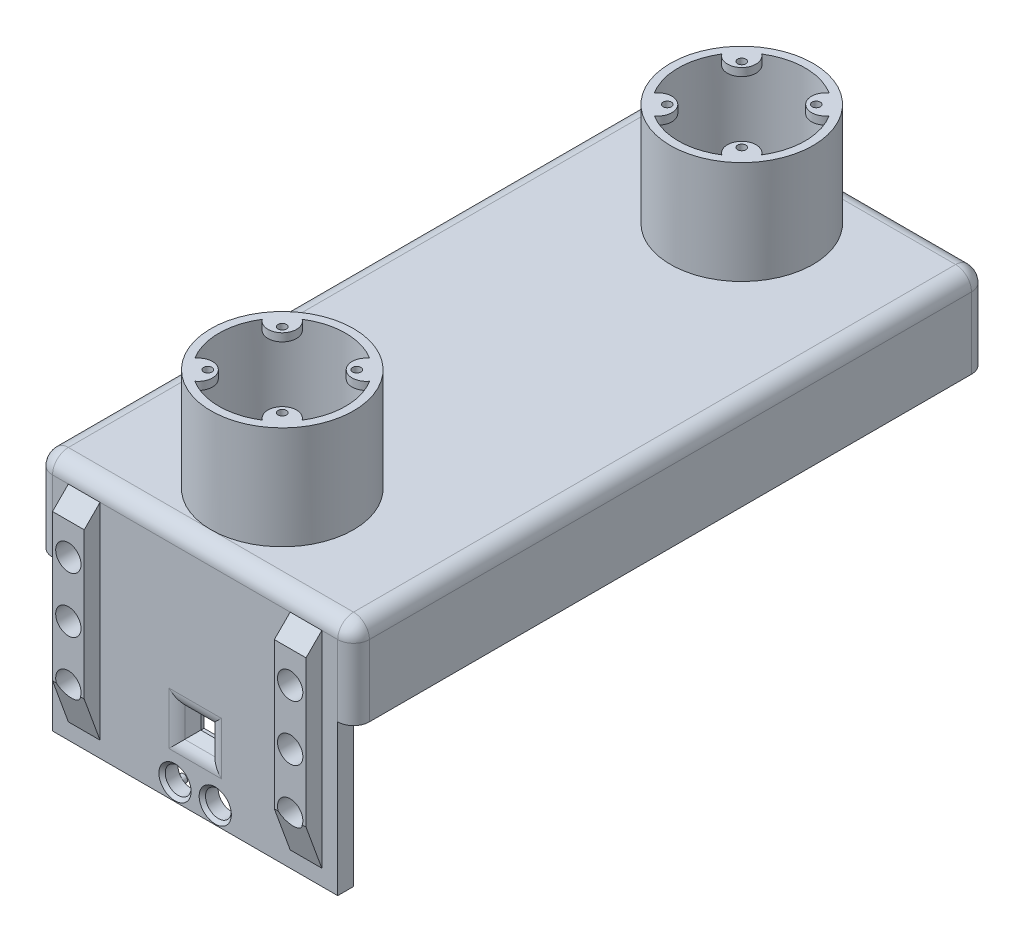
from build123d import *
from build123d.topology import SkipClean

# Parameters (mm, degrees)
SKETCH1_W            = 180
SKETCH1_H            = 150
BOSS_EXTRUDE1_DEPTH  = 10
SKETCH2_W            = 20
SKETCH2_H            = 130
BOSS_EXTRUDE2_DEPTH  = 10
CUT_EXTRUDE1_REACH   = 120.849
SKETCH3_R            = 8
CHAMFER1_SIZE        = 10
CHAMFER2_SIZE        = 27.474774195
CHAMFER2_SIZE_2      = 10
SKETCH5_W            = 200
SKETCH5_H            = 400
BOSS_EXTRUDE4_DEPTH  = 10
SKETCH6_W            = 200
SKETCH6_H            = 55
BOSS_EXTRUDE5_DEPTH  = 10
SKETCH7_W            = 10
SKETCH7_H            = 400
BOSS_EXTRUDE6_DEPTH  = 45
FILLET1_R            = 10
SKETCH9_R            = 40
CUT_EXTRUDE2_DEPTH   = 10
SKETCH10_W           = 380
SKETCH10_H           = 10
BOSS_EXTRUDE7_DEPTH  = 180
SKETCH11_W           = 180
SKETCH11_H           = 200
SKETCH11_W_2         = 30
SKETCH11_H_2         = 20
CUT_EXTRUDE5_DEPTH   = 10
BOSS_EXTRUDE8_START  = 60
SKETCH13_R           = 45
SKETCH13_R_2         = 40
BOSS_EXTRUDE8_DEPTH  = 60
BOSS_EXTRUDE9_START  = 5
SKETCH14_R           = 45
SKETCH14_R_2         = 2.6
BOSS_EXTRUDE9_DEPTH  = 5
SKETCH17_R           = 2.5
SKETCH17_R_2         = 1.5
BOSS_EXTRUDE10_DEPTH = 3
SKETCH18_R           = 8.15
CUT_EXTRUDE6_DEPTH   = 427.262829719
CHAMFER3_SIZE        = 2
SKETCH20_R           = 1.8
SKETCH20_R_2         = 1.05
BOSS_EXTRUDE11_DEPTH = 2
SKETCH21_W           = 8.8
SKETCH21_H           = 8.8
CUT_EXTRUDE7_DEPTH   = 427.262829719
CHAMFER4_SIZE        = 8
FILLET2_R            = 10
SKETCH22_W           = 180
SKETCH22_H           = 380
CUT_EXTRUDE8_DEPTH   = 10


# Some blends are built 0.0001 mm under size
with BuildPart() as part:
    # Sketch1 → Boss-Extrude1 (new body)
    with BuildSketch(Plane.XY):
        Rectangle(SKETCH1_W, SKETCH1_H)
    extrude(amount=BOSS_EXTRUDE1_DEPTH)

    # Sketch2 → Boss-Extrude2 (add)
    with BuildSketch(Plane.XY.offset(10)):
        with Locations((70, 0)):
            Rectangle(SKETCH2_W, SKETCH2_H)
        with Locations((-70, 0)):
            Rectangle(SKETCH2_W, SKETCH2_H)
    extrude(amount=BOSS_EXTRUDE2_DEPTH)

    # Sketch3 → Cut-Extrude1 (cut, up to next)
    with BuildSketch(Plane.XY.offset(20), mode=Mode.PRIVATE) as cut_extrude1_sk1:
        with Locations((-70, 0)):
            Circle(SKETCH3_R)
    cut_extrude1_tool1 = extrude(cut_extrude1_sk1.sketch, amount=-CUT_EXTRUDE1_REACH, mode=Mode.PRIVATE) & part.part
    # Sketch3 → Cut-Extrude1 (cut, up to next)
    with BuildSketch(Plane.XY.offset(20), mode=Mode.PRIVATE) as cut_extrude1_sk2:
        with Locations((-70, -35)):
            Circle(SKETCH3_R)
    cut_extrude1_tool2 = extrude(cut_extrude1_sk2.sketch, amount=-CUT_EXTRUDE1_REACH, mode=Mode.PRIVATE) & part.part
    # Sketch3 → Cut-Extrude1 (cut, up to next)
    with BuildSketch(Plane.XY.offset(20), mode=Mode.PRIVATE) as cut_extrude1_sk3:
        with Locations((-70, 35)):
            Circle(SKETCH3_R)
    cut_extrude1_tool3 = extrude(cut_extrude1_sk3.sketch, amount=-CUT_EXTRUDE1_REACH, mode=Mode.PRIVATE) & part.part
    # Sketch3 → Cut-Extrude1 (cut, up to next)
    with BuildSketch(Plane.XY.offset(20), mode=Mode.PRIVATE) as cut_extrude1_sk4:
        with Locations(Location((70, -35, 0), (0, 0, 180))):
            Circle(SKETCH3_R)
    cut_extrude1_tool4 = extrude(cut_extrude1_sk4.sketch, amount=-CUT_EXTRUDE1_REACH, mode=Mode.PRIVATE) & part.part
    # Sketch3 → Cut-Extrude1 (cut, up to next)
    with BuildSketch(Plane.XY.offset(20), mode=Mode.PRIVATE) as cut_extrude1_sk5:
        with Locations(Location((70, 0, 0), (0, 0, 180))):
            Circle(SKETCH3_R)
    cut_extrude1_tool5 = extrude(cut_extrude1_sk5.sketch, amount=-CUT_EXTRUDE1_REACH, mode=Mode.PRIVATE) & part.part
    # Sketch3 → Cut-Extrude1 (cut, up to next)
    with BuildSketch(Plane.XY.offset(20), mode=Mode.PRIVATE) as cut_extrude1_sk6:
        with Locations(Location((70, 35, 0), (0, 0, 180))):
            Circle(SKETCH3_R)
    cut_extrude1_tool6 = extrude(cut_extrude1_sk6.sketch, amount=-CUT_EXTRUDE1_REACH, mode=Mode.PRIVATE) & part.part
    add(cut_extrude1_tool1.solids().sort_by_distance((-70, 0, 20))[0], mode=Mode.SUBTRACT)
    add(cut_extrude1_tool2.solids().sort_by_distance((-70, -35, 20))[0], mode=Mode.SUBTRACT)
    add(cut_extrude1_tool3.solids().sort_by_distance((-70, 35, 20))[0], mode=Mode.SUBTRACT)
    add(cut_extrude1_tool4.solids().sort_by_distance((70, -35, 20))[0], mode=Mode.SUBTRACT)
    add(cut_extrude1_tool5.solids().sort_by_distance((70, 0, 20))[0], mode=Mode.SUBTRACT)
    add(cut_extrude1_tool6.solids().sort_by_distance((70, 35, 20))[0], mode=Mode.SUBTRACT)

    # Chamfer1
    chamfer1_edges = [part.edges().sort_by_distance(p)[0] for p in [
        (70, 65, 20),
        (-70, 65, 20),
    ]]
    chamfer(chamfer1_edges, length=CHAMFER1_SIZE - 0.0001)  # a hair under: the kernel refuses the full size

    # Chamfer2
    # the kernel refuses this chamfer: 27.474774195, 10 mm, written as the material it takes off along each edge
    with BuildSketch(Plane(origin=(-11.274914494, -65, 20), x_dir=(0, 0.9999130865277315, 0.013184058198645822), z_dir=(1, 0, 0))) as chamfer2_piece_1_section:
        Polygon((CHAMFER2_SIZE * 0.999913086511, -CHAMFER2_SIZE * 0.0131840581984), (-CHAMFER2_SIZE_2 * 0.0131840581986, -CHAMFER2_SIZE_2 * 0.999913086528), (0, 0), align=None)
    chamfer2_piece_1 = extrude(amount=162.549828987, mode=Mode.PRIVATE)
    chamfer2_piece_1 = split(chamfer2_piece_1, bisect_by=Plane(origin=(70, -55.574652425, 10), z_dir=(0, 0, 1)), keep=Keep.TOP, mode=Mode.PRIVATE)
    add(chamfer2_piece_1, mode=Mode.SUBTRACT)
    with BuildSketch(Plane(origin=(-151.274914494, -65, 20), x_dir=(0, -0.09904090225205088, -0.9950833631817486), z_dir=(1, 0, 0))) as chamfer2_piece_2_section:
        Polygon((CHAMFER2_SIZE_2 * 0.995083363182, CHAMFER2_SIZE_2 * 0.0990409022521), (-CHAMFER2_SIZE * 0.0990409022504, CHAMFER2_SIZE * 0.995083363165), (0, 0), align=None)
    chamfer2_piece_2 = extrude(amount=162.549828987, mode=Mode.PRIVATE)
    chamfer2_piece_2 = split(chamfer2_piece_2, bisect_by=Plane(origin=(-70, -55.574652425, 10), z_dir=(0, 0, 1)), keep=Keep.TOP, mode=Mode.PRIVATE)
    add(chamfer2_piece_2, mode=Mode.SUBTRACT)

    # Sketch5 → Boss-Extrude4 (add)
    with BuildSketch(Plane(origin=(0, 75, 0), x_dir=(1, 0, 0), z_dir=(0, 1, 0))):
        with Locations((0, 190)):
            Rectangle(SKETCH5_W, SKETCH5_H)
    extrude(amount=-BOSS_EXTRUDE4_DEPTH)

    # Sketch6 → Boss-Extrude5 (add)
    with BuildSketch(Plane(origin=(0, 0, -390), x_dir=(-1, 0, 0), z_dir=(0, 0, -1))):
        with Locations((0, 47.5)):
            Rectangle(SKETCH6_W, SKETCH6_H)
    extrude(amount=-BOSS_EXTRUDE5_DEPTH)

    # Sketch7 → Boss-Extrude6 (add)
    with BuildSketch(Plane.XZ.offset(-65)):
        with Locations((-95, -190)):
            Rectangle(SKETCH7_W, SKETCH7_H)
        with Locations((95, -190)):
            Rectangle(SKETCH7_W, SKETCH7_H)
    extrude(amount=BOSS_EXTRUDE6_DEPTH)

    # Fillet1
    fillet1_edges = [part.edges().sort_by_distance(p)[0] for p in [
        (-100, 75, -190),
        (100, 75, -190),
        (0, 75, -390),
        (0, 75, 10),
        (100, 47.5, 10),
        (100, 47.5, -390),
        (-100, 47.5, -390),
        (-100, 47.5, 10),
    ]]
    fillet(fillet1_edges, radius=FILLET1_R - 0.0001)  # a hair under: the kernel refuses the full size

    # Sketch9 → Cut-Extrude2 (cut)
    with BuildSketch(Plane(origin=(0, 75, 0), x_dir=(1, 0, 0), z_dir=(0, 1, 0))):
        with Locations(Location((0, 45, 0), (0, 0, 270))):
            Circle(SKETCH9_R)
        with Locations(Location((0, 335, 0), (0, 0, 270))):
            Circle(SKETCH9_R)
    extrude(amount=-CUT_EXTRUDE2_DEPTH, mode=Mode.SUBTRACT)

    # Sketch10 → Boss-Extrude7 (add)
    with BuildSketch(Plane(origin=(-90, 0, 0), x_dir=(0, 0, -1), z_dir=(1, 0, 0))):
        with Locations((190, 25)):
            Rectangle(SKETCH10_W, SKETCH10_H)
    extrude(amount=BOSS_EXTRUDE7_DEPTH)

    # Sketch11 → Cut-Extrude5 (cut)
    with BuildSketch(Plane.XZ.offset(-20)):
        with Locations((0, -190)):
            Rectangle(SKETCH11_W, SKETCH11_H)
        with Locations((-75, -10)):
            Rectangle(SKETCH11_W_2, SKETCH11_H_2)
        with Locations((75, -10)):
            Rectangle(SKETCH11_W_2, SKETCH11_H_2)
    extrude(amount=-CUT_EXTRUDE5_DEPTH, mode=Mode.SUBTRACT)

    # Sketch13 → Boss-Extrude8 (add)
    # profile 1 of 2: a face of its own
    with BuildSketch(Plane(origin=(0, 75, 0), x_dir=(1, 0, 0), z_dir=(0, 1, 0)).offset(BOSS_EXTRUDE8_START)):
        with Locations(Location((0, 45, 0), (0, 0, 270))):
            Circle(SKETCH13_R)
        with Locations(Location((0, 45, 0), (0, 0, 270))):
            Circle(SKETCH13_R_2, mode=Mode.SUBTRACT)
    # profile 2 of 2: a face of its own
    with BuildSketch(Plane(origin=(0, 75, 0), x_dir=(1, 0, 0), z_dir=(0, 1, 0)).offset(BOSS_EXTRUDE8_START)):
        with Locations(Location((0, 335, 0), (0, 0, 90))):
            Circle(SKETCH13_R)
        with Locations(Location((0, 335, 0), (0, 0, 270))):
            Circle(SKETCH13_R_2, mode=Mode.SUBTRACT)
    extrude(amount=-BOSS_EXTRUDE8_DEPTH)

    # Sketch14 → Boss-Extrude9 (add)
    # profile 1 of 2: a face of its own
    with SkipClean():  # the faces are left unmerged after this step: merging them gives an invalid solid
        with BuildSketch(Plane(origin=(0, 135, 0), x_dir=(1, 0, 0), z_dir=(0, 1, 0)).offset(BOSS_EXTRUDE9_START)):
            with Locations(Location((0, 335, 0), (0, 0, 90))):
                Circle(SKETCH14_R)
            with Locations(Location((-23.5, 358.5, 0), (0, 0, 270))):
                Circle(SKETCH14_R_2, mode=Mode.SUBTRACT)
            with Locations(Location((23.5, 358.5, 0), (0, 0, 90))):
                Circle(SKETCH14_R_2, mode=Mode.SUBTRACT)
            with Locations(Location((23.5, 311.5, 0), (0, 0, 270))):
                Circle(SKETCH14_R_2, mode=Mode.SUBTRACT)
            with Locations(Location((-23.5, 311.5, 0), (0, 0, 90))):
                Circle(SKETCH14_R_2, mode=Mode.SUBTRACT)
            with BuildLine():
                ThreePointArc((-33.857305724, 356.299832138), (-20.176598128, 355.176598128), (-21.299832138, 368.857305724))
                ThreePointArc((-21.299832138, 368.857305724), (0, 375), (21.299832138, 368.857305724))
                ThreePointArc((21.299832138, 368.857305724), (20.176598128, 355.176598128), (33.857305724, 356.299832138))
                ThreePointArc((33.857305724, 356.299832138), (40, 335), (33.857305724, 313.700167862))
                ThreePointArc((33.857305724, 313.700167862), (20.176598128, 314.823401872), (21.299832138, 301.142694276))
                ThreePointArc((21.299832138, 301.142694276), (0, 295), (-21.299832138, 301.142694276))
                ThreePointArc((-21.299832138, 301.142694276), (-20.176598128, 314.823401872), (-33.857305724, 313.700167862))
                ThreePointArc((-33.857305724, 313.700167862), (-40, 335), (-33.857305724, 356.299832138))
            make_face(mode=Mode.SUBTRACT)
        # profile 2 of 2: a face of its own
        with BuildSketch(Plane(origin=(0, 135, 0), x_dir=(1, 0, 0), z_dir=(0, 1, 0)).offset(BOSS_EXTRUDE9_START)):
            with Locations(Location((0, 45, 0), (0, 0, 90))):
                Circle(SKETCH14_R)
            with Locations(Location((-23.5, 68.5, 0), (0, 0, 270))):
                Circle(SKETCH14_R_2, mode=Mode.SUBTRACT)
            with Locations(Location((23.5, 68.5, 0), (0, 0, 90))):
                Circle(SKETCH14_R_2, mode=Mode.SUBTRACT)
            with Locations(Location((23.5, 21.5, 0), (0, 0, 270))):
                Circle(SKETCH14_R_2, mode=Mode.SUBTRACT)
            with Locations(Location((-23.5, 21.5, 0), (0, 0, 90))):
                Circle(SKETCH14_R_2, mode=Mode.SUBTRACT)
            with BuildLine():
                ThreePointArc((-33.857305724, 23.700167862), (-40, 45), (-33.857305724, 66.299832138))
                ThreePointArc((-33.857305724, 66.299832138), (-20.176598128, 65.176598128), (-21.299832138, 78.857305724))
                ThreePointArc((-21.299832138, 78.857305724), (0, 85), (21.299832138, 78.857305724))
                ThreePointArc((21.299832138, 78.857305724), (20.176598128, 65.176598128), (33.857305724, 66.299832138))
                ThreePointArc((33.857305724, 66.299832138), (40, 45), (33.857305724, 23.700167862))
                ThreePointArc((33.857305724, 23.700167862), (20.176598128, 24.823401872), (21.299832138, 11.142694276))
                ThreePointArc((21.299832138, 11.142694276), (0, 5), (-21.299832138, 11.142694276))
                ThreePointArc((-21.299832138, 11.142694276), (-20.176598128, 24.823401872), (-33.857305724, 23.700167862))
            make_face(mode=Mode.SUBTRACT)
        extrude(amount=-BOSS_EXTRUDE9_DEPTH)

    # Sketch17 → Boss-Extrude10 (add)
    # profile 1 of 2: a face of its own
    with SkipClean():  # the faces are left unmerged after this step: merging them gives an invalid solid
        with BuildSketch(Plane(origin=(0, 0, 0), x_dir=(-1, 0, 0), z_dir=(0, 0, -1))):
            with Locations((-20.35, -56.2)):
                Circle(SKETCH17_R)
            with Locations((-20.35, -56.2)):
                Circle(SKETCH17_R_2, mode=Mode.SUBTRACT)
        # profile 2 of 2: a face of its own
        with BuildSketch(Plane(origin=(0, 0, 0), x_dir=(-1, 0, 0), z_dir=(0, 0, -1))):
            with Locations(Location((20.35, -72.5, 0), (0, 0, 270))):
                Circle(SKETCH17_R)
            with Locations((20.35, -72.5)):
                Circle(SKETCH17_R_2, mode=Mode.SUBTRACT)
        extrude(amount=BOSS_EXTRUDE10_DEPTH)

    # Sketch18 → Cut-Extrude6 (cut, through all)
    with SkipClean():  # the faces are left unmerged after this step: merging them gives an invalid solid
        with BuildSketch(Plane(origin=(0, 0, 0), x_dir=(-1, 0, 0), z_dir=(0, 0, -1))):
            with Locations((-12.7, -64.35)):
                Circle(SKETCH18_R)
            with Locations((12.7, -64.35)):
                Circle(SKETCH18_R)
        extrude(amount=-CUT_EXTRUDE6_DEPTH, mode=Mode.SUBTRACT)

    # Chamfer3
    chamfer3_edges = [part.edges().sort_by_distance(p)[0] for p in [
        (20.85, -64.35, 10),
        (-4.55, -64.35, 10),
    ]]
    chamfer(chamfer3_edges, length=CHAMFER3_SIZE)

    # Sketch20 → Boss-Extrude11 (add)
    # profile 1 of 4: a face of its own
    with SkipClean():  # the faces are left unmerged after this step: merging them gives an invalid solid
        with BuildSketch(Plane(origin=(0, 0, 0), x_dir=(-1, 0, 0), z_dir=(0, 0, -1))):
            with Locations((-10.5, -30.9)):
                Circle(SKETCH20_R)
            with Locations((-10.5, -30.9)):
                Circle(SKETCH20_R_2, mode=Mode.SUBTRACT)
        # profile 2 of 4: a face of its own
        with BuildSketch(Plane(origin=(0, 0, 0), x_dir=(-1, 0, 0), z_dir=(0, 0, -1))):
            with Locations((10.5, -30.9)):
                Circle(SKETCH20_R)
            with Locations((10.5, -30.9)):
                Circle(SKETCH20_R_2, mode=Mode.SUBTRACT)
        # profile 3 of 4: a face of its own
        with BuildSketch(Plane(origin=(0, 0, 0), x_dir=(-1, 0, 0), z_dir=(0, 0, -1))):
            with Locations((10.5, -43.2)):
                Circle(SKETCH20_R)
            with Locations((10.5, -43.2)):
                Circle(SKETCH20_R_2, mode=Mode.SUBTRACT)
        # profile 4 of 4: a face of its own
        with BuildSketch(Plane(origin=(0, 0, 0), x_dir=(-1, 0, 0), z_dir=(0, 0, -1))):
            with Locations((-10.5, -43.2)):
                Circle(SKETCH20_R)
            with Locations((-10.5, -43.2)):
                Circle(SKETCH20_R_2, mode=Mode.SUBTRACT)
        extrude(amount=BOSS_EXTRUDE11_DEPTH)

    # Sketch21 → Cut-Extrude7 (cut, through all)
    with SkipClean():  # the faces are left unmerged after this step: merging them gives an invalid solid
        with BuildSketch(Plane(origin=(0, 0, 0), x_dir=(-1, 0, 0), z_dir=(0, 0, -1))):
            with Locations((0, -31.3)):
                Rectangle(SKETCH21_W, SKETCH21_H)
        extrude(amount=-CUT_EXTRUDE7_DEPTH, mode=Mode.SUBTRACT)

    # Chamfer4
    chamfer4_edges = [part.edges().sort_by_distance(p)[0] for p in [
        (4.4, -31.3, 10),
        (0, -35.7, 10),
        (-4.4, -31.3, 10),
        (0, -26.9, 10),
    ]]
    chamfer(chamfer4_edges, length=CHAMFER4_SIZE)

    # Fillet2
    fillet2_edges = [part.edges().sort_by_distance(p)[0] for p in [
        (0, -18.9, 10),
        (12.4, -31.3, 10),
        (-12.4, -31.3, 10),
        (0, -43.7, 10),
    ]]
    fillet(fillet2_edges, radius=FILLET2_R)

    # Sketch22 → Cut-Extrude8 (cut)
    with SkipClean():  # the faces are left unmerged after this step: merging them gives an invalid solid
        with BuildSketch(Plane.XZ.offset(-20)):
            with Locations((0, -190)):
                Rectangle(SKETCH22_W, SKETCH22_H)
        extrude(amount=-CUT_EXTRUDE8_DEPTH, mode=Mode.SUBTRACT)


solid = part.part
